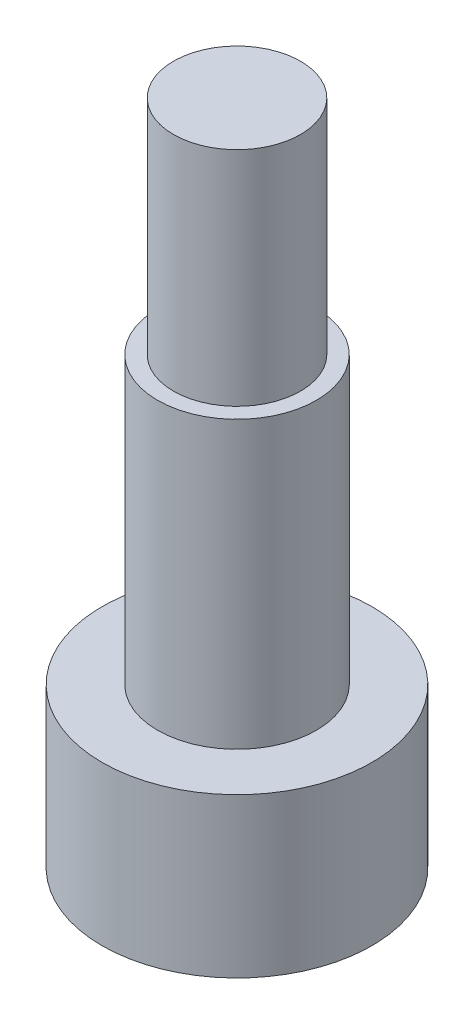
from build123d import *

# Parameters (mm, degrees)
CUT_EXTRUDE1_DEPTH = 2


with BuildPart() as part:
    # Sketch1 → Revolve1 (revolve)
    with BuildSketch(Plane.XY):
        Polygon((0, 0), (4.25, 0), (4.25, 5), (2.5, 5), (2.5, 14), (2, 14), (2, 21), (0, 21), align=None)
    revolve(axis=Axis((0, 21, 0), (0, -1, 0)))

    # Sketch2 → Cut-Extrude1 (cut)
    with BuildSketch(Plane.XZ):
        Polygon((0, -1.732050808), (1.5, -0.866025404), (1.5, 0.866025404), (0, 1.732050808), (-1.5, 0.866025404), (-1.5, -0.866025404), align=None)
    extrude(amount=-CUT_EXTRUDE1_DEPTH, mode=Mode.SUBTRACT)


solid = part.part
